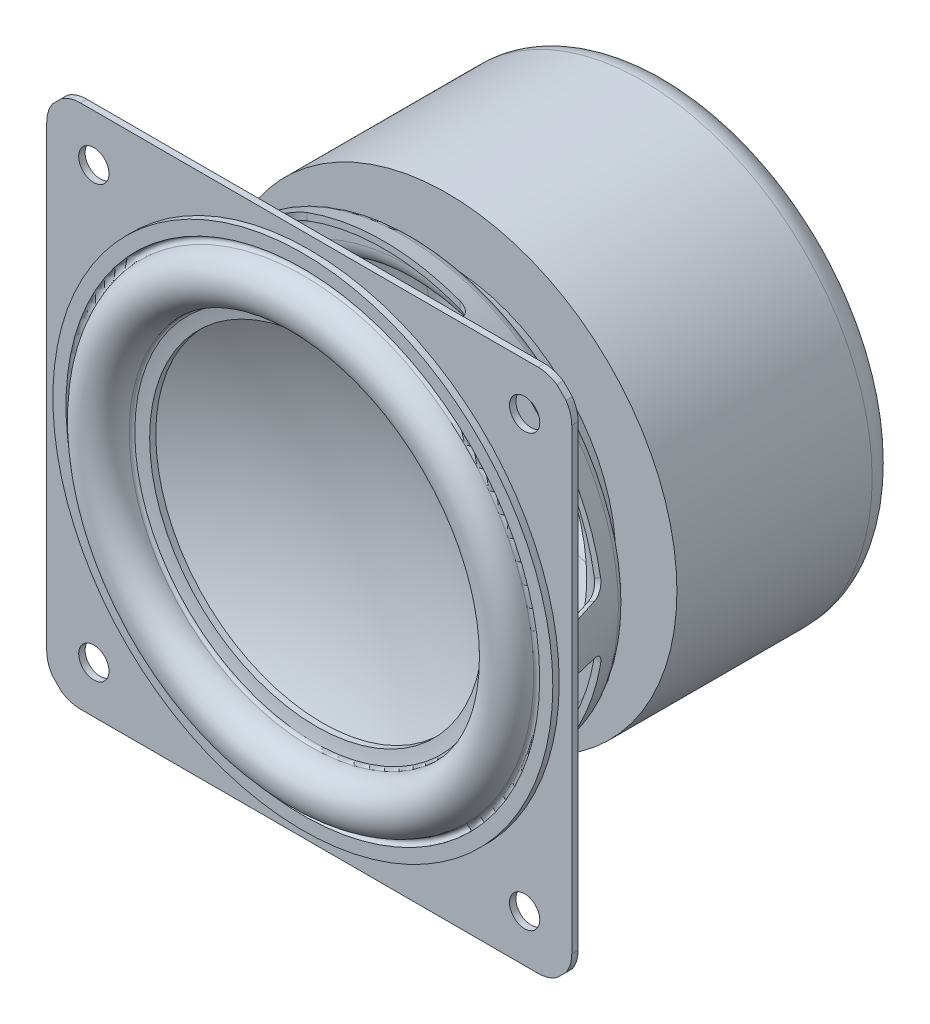
from build123d import *

# Parameters (mm, degrees)
SKETCH2_OUTSIDE_W    = 139.834
SKETCH2_OUTSIDE_H    = 139.834
CUT_EXTRUDE1_DEPTH   = 93.088272869
M4_CLEARANCE_HOLE1_D = 4.5
CUT_EXTRUDE2_START   = -9.774206205
CUT_EXTRUDE2_DEPTH   = 5.870126288
CIRPATTERN2_COUNT    = 6


with BuildPart() as part:
    # Sketch1 → Revolve1 (revolve)
    with BuildSketch(Plane(origin=(0, 0, 0), x_dir=(0, 0, -1), z_dir=(1, 0, 0)), mode=Mode.PRIVATE) as revolve1_sk:
        with BuildLine():
            Line((0, 53), (0, 0))
            Line((0, 0), (53.5, 0))
            Line((53.5, 0), (53.5, 30.125))
            ThreePointArc((53.5, 30.125), (52.328427125, 32.953427125), (49.5, 34.125))
            Line((49.5, 34.125), (20.5, 34.125))
            Line((20.5, 34.125), (20.5, 25))
            Line((20.5, 25), (16.969841062, 25.97049043))
            ThreePointArc((16.969841062, 25.97049043), (15.909352667, 26.686573548), (15.5, 27.898943566))
            Line((15.5, 27.898943566), (15.5, 29.97562688))
            ThreePointArc((15.5, 29.97562688), (15.090647333, 31.187996899), (14.030158938, 31.904080017))
            Line((14.030158938, 31.904080017), (2.419841062, 35.095919983))
            ThreePointArc((2.419841062, 35.095919983), (1.359352667, 35.812003101), (0.95, 37.02437312))
            Line((0.95, 37.02437312), (0.95, 53))
            Line((0.95, 53), (0, 53))
        make_face()
    revolve(revolve1_sk.sketch.rotate(Axis((0, 0, 0), (0, 0, -1)), 90), axis=Axis((0, 0, 0), (0, 0, -1)))

    # Shell1: read off the stored shape, not the designer's step
    # Shell1 outline → Shell1 (revolve, cut)
    with BuildSketch(Plane.XZ):
        with BuildLine():
            Line((0, 0), (0, -52.55))
            Line((0, -52.55), (30.125, -52.55))
            ThreePointArc((30.125, -52.55), (32.281675683, -51.656675683), (33.175, -49.5))
            Line((33.175, -49.5), (33.175, -21.45))
            Line((33.175, -21.45), (23.753585998, -21.45))
            Line((23.753585998, -21.45), (25.05447519, -16.718015567))
            ThreePointArc((25.05447519, -16.718015567), (26.110697789, -15.153795184), (27.898943566, -14.55))
            Line((27.898943566, -14.55), (29.97562688, -14.55))
            ThreePointArc((29.97562688, -14.55), (30.61212114, -14.33508985), (30.988064777, -13.778333442))
            Line((30.988064777, -13.778333442), (34.179904743, -2.168015567))
            ThreePointArc((34.179904743, -2.168015567), (35.236127342, -0.603795184), (37.02437312, 0))
            Line((37.02437312, 0), (0, 0))
        make_face()
    revolve(axis=Axis((0, 0, 0), (0, 0, 1)), mode=Mode.SUBTRACT)

    # Sketch2 outside → Cut-Extrude1 (cut, through all)
    with BuildSketch(Plane.XY):
        Rectangle(SKETCH2_OUTSIDE_W, SKETCH2_OUTSIDE_H)
        with BuildLine():
            Line((-34, 39), (34, 39))
            ThreePointArc((34, 39), (37.535533906, 37.535533906), (39, 34))
            Line((39, 34), (39, -34))
            ThreePointArc((39, -34), (37.535533906, -37.535533906), (34, -39))
            Line((34, -39), (-34, -39))
            ThreePointArc((-34, -39), (-37.535533906, -37.535533906), (-39, -34))
            Line((-39, -34), (-39, 34))
            ThreePointArc((-39, 34), (-37.535533906, 37.535533906), (-34, 39))
        make_face(mode=Mode.SUBTRACT)
    extrude(amount=-CUT_EXTRUDE1_DEPTH, mode=Mode.SUBTRACT)

    # M4 Clearance Hole1 (through all)
    with Locations(Plane.XY):
        with Locations((-32, 32), (32, 32), (32, -32), (-32, -32)):
            Hole(M4_CLEARANCE_HOLE1_D / 2)

    # Sketch5 → Revolve3 (revolve)
    with BuildSketch(Plane(origin=(0, 0, 0), x_dir=(0, 0, -1), z_dir=(1, 0, 0)), mode=Mode.PRIVATE) as revolve3_sk:
        with BuildLine():
            Line((0, 36.185), (0, 37.135))
            Line((0, 37.135), (-0.95, 37.135))
            Line((-0.95, 37.135), (-0.95, 35.185))
            ThreePointArc((-0.95, 35.185), (-0.438494272, 34.736985242), (-0.843375132, 34.19070068))
            ThreePointArc((-0.843375132, 34.19070068), (-3.771053552, 30.073462021), (0.219245712, 26.975))
            ThreePointArc((0.219245712, 26.975), (0.531755357, 26.891950919), (0.709875322, 26.622075566))
            ThreePointArc((0.709875322, 26.622075566), (0.896212054, 25.689326606), (1.040651205, 24.749178038))
            Line((1.040651205, 24.749178038), (1.9502907, 24.749178038))
            ThreePointArc((1.9502907, 24.749178038), (1.830126859, 25.794562527), (1.63707262, 26.828969671))
            ThreePointArc((1.63707262, 26.828969671), (1.086504328, 27.663153603), (0.120537924, 27.91985807))
            ThreePointArc((0.120537924, 27.91985807), (-2.831190298, 30.211871072), (-0.665510371, 33.257499669))
            ThreePointArc((-0.665510371, 33.257499669), (0.268840765, 33.875684991), (0.484792907, 34.975016519))
            ThreePointArc((0.484792907, 34.975016519), (0.311120074, 35.424292237), (0, 35.792008463))
            Line((0, 35.792008463), (0, 36.185))
        make_face()
    revolve(revolve3_sk.sketch.rotate(Axis((0, 0, 0), (0, 0, -1)), 90), axis=Axis((0, 0, 0), (0, 0, -1)))

    # Cut-Extrude2: read off the stored shape, not the designer's step
    # Cut-Extrude2 outline → Cut-Extrude2 (cut)
    with BuildSketch(Plane(origin=(0, 39, 0), x_dir=(1, 0, 0), z_dir=(0, 1, 0)).offset(CUT_EXTRUDE2_START)):
        with BuildLine():
            ThreePointArc((-14.055891799, 5.398736008), (-13.629165642, 3.752887263), (-12.090147425, 3.030158938))
            Line((-12.090147425, 3.030158938), (12.090147425, 3.030158938))
            ThreePointArc((12.090147425, 3.030158938), (13.629165642, 3.752887263), (14.055891799, 5.398736008))
            Line((14.055891799, 5.398736008), (13.3058918, 9.398736005))
            ThreePointArc((13.3058918, 9.398736005), (12.617419101, 10.569177153), (11.340147425, 11.030158938))
            Line((11.340147425, 11.030158938), (-11.340147425, 11.030158938))
            ThreePointArc((-11.340147425, 11.030158938), (-12.617419099, 10.569177154), (-13.305891799, 9.398736008))
            Line((-13.305891799, 9.398736008), (-14.055891799, 5.398736008))
        make_face()
    cut_extrude2 = extrude(amount=CUT_EXTRUDE2_DEPTH, mode=Mode.SUBTRACT)

    # CirPattern2: Cut-Extrude2 ×6 about axis
    cirpattern2_axis = Axis((0, 0, 0), (0, 0, 1))
    for i in range(1, CIRPATTERN2_COUNT):
        add(cut_extrude2.rotate(cirpattern2_axis, i * 360 / CIRPATTERN2_COUNT), mode=Mode.SUBTRACT)


with BuildPart() as body_2:
    # Sketch6 → Revolve4 (revolve)
    with BuildSketch(Plane(origin=(0, 0, 0), x_dir=(0, 0, -1), z_dir=(1, 0, 0))):
        with BuildLine():
            Line((1.9502907, 24.749178038), (2.794820077, 25.184229911))
            ThreePointArc((2.794820077, 25.184229911), (7.352131397, 12.956872768), (8.9002907, 0))
            Line((8.9002907, 0), (7.9502907, 0))
            ThreePointArc((7.9502907, 0), (6.428875499, 12.733045723), (1.9502907, 24.749178038))
        make_face()
    revolve(axis=Axis((0, 0, 0), (0, 0, -1)))


solid = Compound([part.part, body_2.part])
